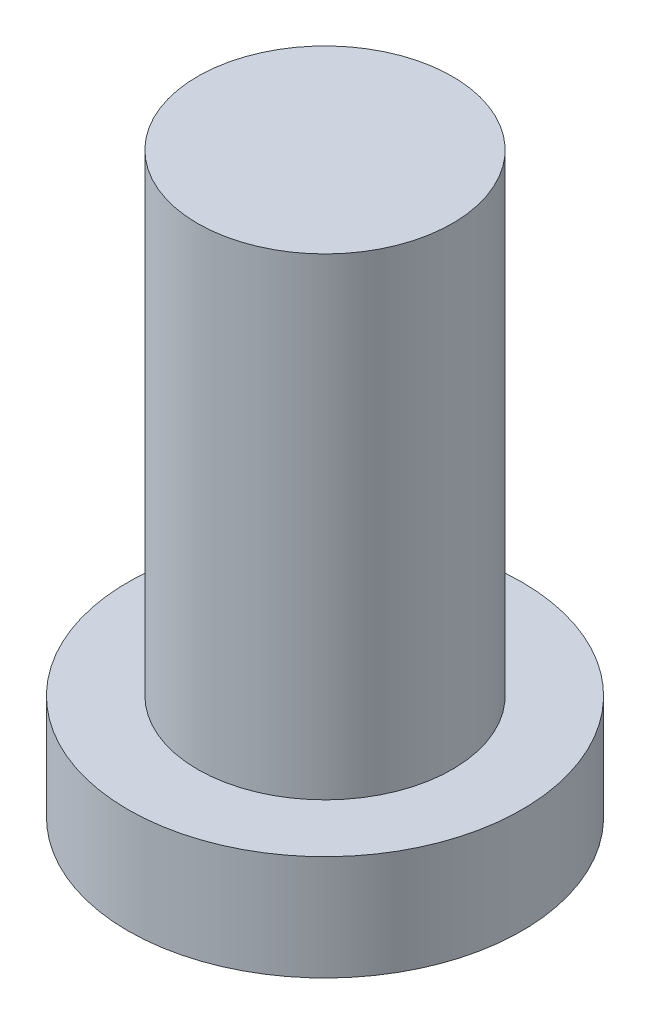
from build123d import *

# Parameters (mm, degrees)
SKETCH1_R           = 7.5
BOSS_EXTRUDE1_DEPTH = 4
SKETCH2_R           = 4.85
BOSS_EXTRUDE5_DEPTH = 18


with BuildPart() as part:
    # Sketch1 → Boss-Extrude1 (new body)
    with BuildSketch(Plane(origin=(0, 0, 0), x_dir=(1, 0, 0), z_dir=(0, 1, 0))):
        Circle(SKETCH1_R)
    extrude(amount=BOSS_EXTRUDE1_DEPTH)

    # Sketch2 → Boss-Extrude5 (add)
    with BuildSketch(Plane(origin=(0, 4, 0), x_dir=(1, 0, 0), z_dir=(0, 1, 0))):
        Circle(SKETCH2_R)
    extrude(amount=BOSS_EXTRUDE5_DEPTH)


solid = part.part
